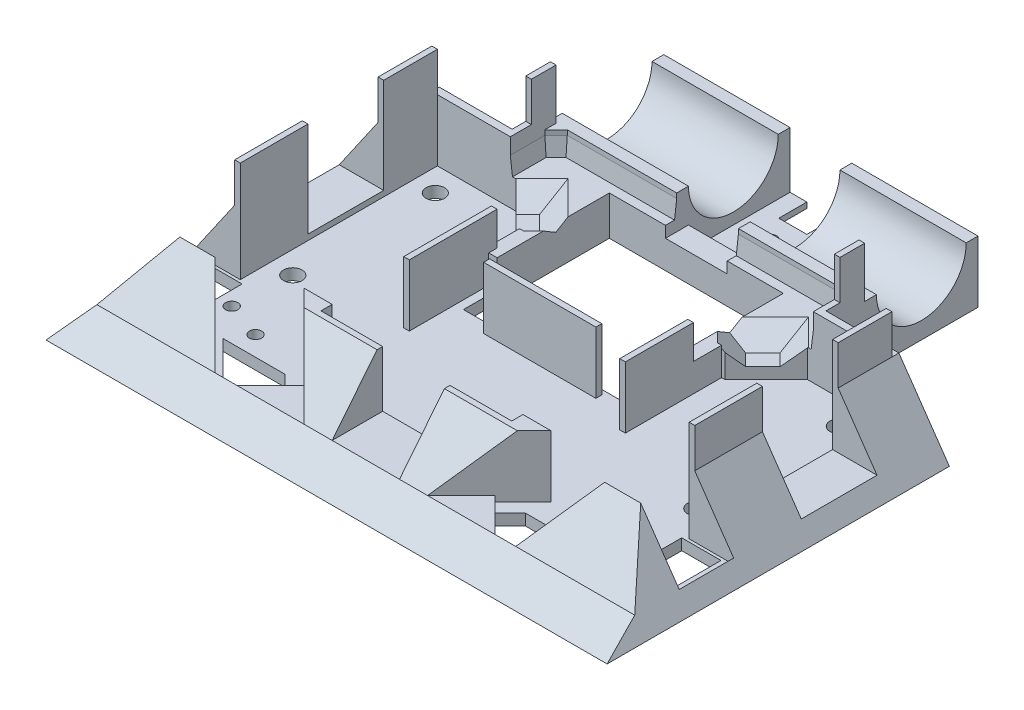
from build123d import *
from OCP.BRepFilletAPI import BRepFilletAPI_MakeChamfer

# Parameters (mm, degrees)
SKETCH1_W                 = 100
SKETCH1_H                 = 95
BOSS_EXTRUDE2_DEPTH       = 20
CUT_EXTRUDE2_DEPTH        = 20
CUT_EXTRUDE3_START        = -22
CUT_EXTRUDE3_DEPTH        = 22
CUT_EXTRUDE4_DEPTH        = 2
SKETCH7_W                 = 12
SKETCH7_H                 = 10
CUT_EXTRUDE5_DEPTH        = 60
BOSS_EXTRUDE3_DEPTH       = 60
BOSS_EXTRUDE3_2_DEPTH     = 60
SKETCH9_W                 = 9.8
SKETCH9_H                 = 15.2
CUT_EXTRUDE6_DEPTH        = 40
SKETCH10_W                = 9.7
SKETCH10_H                = 15.2
CUT_EXTRUDE7_DEPTH        = 40
SKETCH11_W                = 12
SKETCH11_H                = 10
CUT_EXTRUDE8_DEPTH        = 100
SKETCH12_W                = 39.436597342
SKETCH12_H                = 19.718298671
CUT_EXTRUDE9_DEPTH        = 100
CUT_EXTRUDE14_DEPTH       = 100
SKETCH15_W                = 88.678757103
SKETCH15_H                = 15.961506794
CUT_EXTRUDE15_DEPTH       = 100
SKETCH16_W                = 34
SKETCH16_H                = 22
CUT_EXTRUDE16_DEPTH       = 12
SKETCH17_W                = 34
SKETCH17_H                = 12.182986016
BOSS_EXTRUDE4_DEPTH       = 12
SKETCH18_W                = 22
SKETCH18_H                = 34
CUT_EXTRUDE19_DEPTH       = 12
SKETCH19_W                = 36
SKETCH19_H                = 25.876419925
BOSS_EXTRUDE5_DEPTH       = 12
CUT_EXTRUDE20_DEPTH       = 12
SKETCH21_R                = 8.1
CUT_EXTRUDE21_DEPTH       = 100
SKETCH22_W                = 34
SKETCH22_H                = 28.839021914
CUT_EXTRUDE22_DEPTH       = 12
CUT_EXTRUDE23_DEPTH       = 100
CUT_EXTRUDE24_DEPTH       = 12
SKETCH25_W                = 7
SKETCH25_H                = 1.060978086
CUT_EXTRUDE25_DEPTH       = 12
SKETCH26_W                = 1
SKETCH26_H                = 6.751923191
CUT_EXTRUDE26_DEPTH       = 12
SKETCH27_W                = 10
SKETCH27_H                = 20
CUT_EXTRUDE27_DEPTH       = 12
SKETCH28_W                = 15.2
SKETCH28_H                = 9.7
SKETCH28_W_2              = 20.634033895
CUT_EXTRUDE28_DEPTH       = 10
CUT_EXTRUDE29_DEPTH       = 12
SKETCH32_W                = 6.9
SKETCH32_H                = 13
CUT_EXTRUDE30_DEPTH       = 100
SKETCH33_R                = 1.65
CUT_EXTRUDE31_DEPTH       = 10
SKETCH34_W                = 15.575694979
SKETCH34_H                = 1.5
SKETCH34_W_2              = 33.494522517
CUT_EXTRUDE33_DEPTH       = 10
CUT_EXTRUDE34_DEPTH       = 100
SKETCH37_W                = 56
SKETCH37_H                = 20.2
CUT_EXTRUDE35_DEPTH       = 2
SKETCH39_R                = 1.65
CUT_EXTRUDE36_DEPTH       = 5
SKETCH41_W                = 7
SKETCH41_H                = 7
CUT_EXTRUDE37_DEPTH       = 12
CUT_EXTRUDE38_DEPTH       = 25
CUT_EXTRUDE39_DEPTH       = 25
SKETCH44_W                = 10
SKETCH44_H                = 8.7
CUT_EXTRUDE40_DEPTH       = 25
CUT_EXTRUDE41_DEPTH       = 25
SKETCH46_W                = 11
SKETCH46_H                = 11
CUT_EXTRUDE42_DEPTH       = 25
SKETCH47_W                = 1
SKETCH47_H                = 12.058804869
BOSS_EXTRUDE8_DEPTH       = 7
CUT_EXTRUDE46_DEPTH       = 7
SKETCH50_W                = 11
SKETCH50_H                = 6.852562825
SKETCH50_W_2              = 19
SKETCH50_H_2              = 16.839021914
CUT_EXTRUDE47_DEPTH       = 10
SKETCH51_W                = 27
SKETCH51_H                = 23
CUT_EXTRUDE48_DEPTH       = 10
SKETCH52_W                = 11
SKETCH52_H                = 17.852562825
BOSS_EXTRUDE9_DEPTH       = 1
CUT_EXTRUDE49_DEPTH       = 100
CUT_EXTRUDE50_DEPTH       = 10
SKETCH58_W                = 5
SKETCH58_H                = 5
CUT_EXTRUDE51_DEPTH       = 10
SKETCH64_W                = 1
SKETCH64_H                = 8.7
BOSS_EXTRUDE10_DEPTH      = 1
SKETCH65_R                = 1.1
CUT_EXTRUDE52_DEPTH       = 100
SKETCH66_R                = 1.1
SKETCH66_W                = 2
SKETCH66_H                = 8.7
BOSS_EXTRUDE11_DEPTH      = 1
SKETCH67_R                = 1.1
CUT_EXTRUDE53_DEPTH       = 10
BOSS_EXTRUDE12_START      = 1
SKETCH68_R                = 1.65
SKETCH68_R_2              = 1.1
SKETCH68_W                = 7
SKETCH68_H                = 8.7
BOSS_EXTRUDE12_DEPTH      = 1
SKETCH69_W                = 27
SKETCH69_H                = 23
CUT_EXTRUDE54_DEPTH       = 1
CUT_EXTRUDE55_START       = -100
SKETCH70_R                = 1.1
CUT_EXTRUDE55_DEPTH       = 100
SKETCH71_W                = 31
SKETCH71_H                = 27
CUT_EXTRUDE56_DEPTH       = 10
BOSS_EXTRUDE13_DEPTH      = 9
CHAMFER1_SIZE             = 1
CHAMFER1_SIZE_2           = 8.144346428
CHAMFER2_SIZE             = 1
CHAMFER2_SIZE2            = 8.144346428
CHAMFER3_SIZE             = 1
CHAMFER3_SIZE2            = 8.144346428
SKETCH73_W                = 11
SKETCH73_H                = 18.1
CUT_EXTRUDE57_DEPTH       = 1
BOSS_EXTRUDE14_DEPTH      = 5
SKETCH75_W                = 2.5
SKETCH75_H                = 6.488051805
SKETCH75_W_2              = 3.136128614
BOSS_EXTRUDE15_DEPTH      = 11
CUT_EXTRUDE58_DEPTH       = 3
CHAMFER4_SIZE             = 3.575260778
CHAMFER4_SIZE_2           = 3
SKETCH79_W                = 1.5
SKETCH79_H                = 6.488051805
CUT_EXTRUDE59_DEPTH       = 6
SKETCH80_W                = 36
SKETCH80_H                = 5
CUT_EXTRUDE60_DEPTH       = 6
SKETCH81_W                = 0.636128614
SKETCH81_H                = 6.488051805
CUT_EXTRUDE61_DEPTH       = 11
BOSS_EXTRUDE17_DEPTH      = 1
BOSS_EXTRUDE17_DEPTH_BACK = 3
SKETCH84_W                = 9.954004394
SKETCH84_H                = 1.340770626
BOSS_EXTRUDE18_DEPTH      = 6
SKETCH85_W                = 9.954004394
SKETCH85_H                = 0.613922805
BOSS_EXTRUDE19_DEPTH      = 6
SKETCH86_W                = 11
SKETCH86_H                = 4.1
BOSS_EXTRUDE20_DEPTH      = 3
SKETCH87_W                = 3.5
SKETCH87_H                = 11
CUT_EXTRUDE62_DEPTH       = 3
CUT_EXTRUDE63_START       = 2
CUT_EXTRUDE63_DEPTH       = 1
SKETCH91_W                = 11.336755785
SKETCH91_H                = 12.253859608
CUT_EXTRUDE65_DEPTH       = 6
BOSS_EXTRUDE23_START      = -2
BOSS_EXTRUDE23_DEPTH      = 3


with BuildPart() as part:
    # Sketch1 → Boss-Extrude2 (new body)
    with BuildSketch(Plane(origin=(0, 0, 0), x_dir=(1, 0, 0), z_dir=(0, 1, 0))):
        with Locations((9.900990099, -16.559405941)):
            Rectangle(SKETCH1_W, SKETCH1_H)
    extrude(amount=BOSS_EXTRUDE2_DEPTH)

    # Sketch2 → Cut-Extrude2 (cut)
    with BuildSketch(Plane(origin=(59.900990099, 0, 0), x_dir=(0, 0, -1), z_dir=(1, 0, 0))):
        with BuildLine():
            Line((-1.059405941, 0), (28.940594059, 0))
            Line((28.940594059, 0), (30.940594059, 0))
            Line((30.940594059, 0), (30.940594059, 20))
            Line((30.940594059, 20), (25.982188638, 20))
            Line((25.982188638, 20), (1.898999481, 20))
            ThreePointArc((1.898999481, 20), (-2.876419925, 10.487577267), (-1.059405941, 0))
        make_face()
    extrude(amount=-CUT_EXTRUDE2_DEPTH, mode=Mode.SUBTRACT)

    # Sketch3 → Cut-Extrude3 (cut)
    with BuildSketch(Plane.ZY.offset(40.099009901).offset(CUT_EXTRUDE3_START)):
        with BuildLine():
            Line((-1.898999481, 20), (-30.940594059, 20))
            Line((-30.940594059, 20), (-30.940594059, 0))
            Line((-30.940594059, 0), (1.059405941, 0))
            ThreePointArc((1.059405941, 0), (2.876419925, 10.487577267), (-1.898999481, 20))
        make_face()
    extrude(amount=CUT_EXTRUDE3_DEPTH, mode=Mode.SUBTRACT)

    # Sketch5 → Cut-Extrude4 (cut)
    with BuildSketch(Plane(origin=(39.900990099, 0, 0), x_dir=(0, 0, -1), z_dir=(1, 0, 0))):
        with BuildLine():
            Line((19.633434706, 24.018475751), (30.940594059, 20))
            Line((30.940594059, 20), (30.940594059, 0))
            Line((30.940594059, 0), (21.215348762, -7.364828148))
            ThreePointArc((21.215348762, -7.364828148), (-3.037850309, 7.144180617), (19.633434706, 24.018475751))
        make_face()
    extrude(amount=-CUT_EXTRUDE4_DEPTH, mode=Mode.SUBTRACT)

    # Sketch7 → Cut-Extrude5 (cut)
    with BuildSketch(Plane.XY.offset(64.059405941)):
        with Locations((9.900990099, 8)):
            Rectangle(SKETCH7_W, SKETCH7_H)
    extrude(amount=-CUT_EXTRUDE5_DEPTH, mode=Mode.SUBTRACT)

    # Sketch9 → Cut-Extrude6 (cut)
    with BuildSketch(Plane(origin=(33.98019802, 0, 33.98019802), x_dir=(0.7071067811865472, 0, -0.7071067811865479), z_dir=(0.7071067811865479, 0, 0.7071067811865472))):
        with Locations((-47.438423787, 10.6)):
            Rectangle(SKETCH9_W, SKETCH9_H)
    extrude(amount=-CUT_EXTRUDE6_DEPTH, mode=Mode.SUBTRACT)

    # Sketch10 → Cut-Extrude7 (cut)
    with BuildSketch(Plane(origin=(-24.079207921, 0, 24.079207921), x_dir=(0.7071067811865496, 0, 0.7071067811865456), z_dir=(-0.7071067811865456, 0, 0.7071067811865496))):
        with Locations((61.390538266, 10.6)):
            Rectangle(SKETCH10_W, SKETCH10_H)
    extrude(amount=-CUT_EXTRUDE7_DEPTH, mode=Mode.SUBTRACT)

    # Sketch11 → Cut-Extrude8 (cut)
    with BuildSketch(Plane(origin=(59.900990099, 0, 0), x_dir=(0, 0, -1), z_dir=(1, 0, 0))):
        with Locations((-19.876419925, 8)):
            Rectangle(SKETCH11_W, SKETCH11_H)
    extrude(amount=-CUT_EXTRUDE8_DEPTH, mode=Mode.SUBTRACT)

    # Sketch13 → Cut-Extrude14 (cut)
    with BuildSketch(Plane(origin=(59.900990099, 0, 0), x_dir=(0, 0, -1), z_dir=(1, 0, 0))):
        Polygon((-64.059405941, 0), (-57.059405941, 3), (-49.059405941, 13), (-49.059405941, 20), (-64.059405941, 20), (-64.059405941, 13), align=None)
    extrude(amount=-CUT_EXTRUDE14_DEPTH, mode=Mode.SUBTRACT)

    # Sketch15 → Cut-Extrude15 (cut)
    with BuildSketch(Plane(origin=(59.900990099, 0, 0), x_dir=(0, 0, -1), z_dir=(1, 0, 0))):
        with Locations((-4.72002739, 20.980753397)):
            Rectangle(SKETCH15_W, SKETCH15_H)
    extrude(amount=-CUT_EXTRUDE15_DEPTH, mode=Mode.SUBTRACT)

    # Sketch16 → Cut-Extrude16 (cut)
    with BuildSketch(Plane(origin=(0, 13, 0), x_dir=(1, 0, 0), z_dir=(0, 1, 0))):
        with Locations((9.900990099, -37.059405941)):
            Rectangle(SKETCH16_W, SKETCH16_H)
    extrude(amount=-CUT_EXTRUDE16_DEPTH, mode=Mode.SUBTRACT)

    # Sketch17 → Boss-Extrude4 (add)
    with BuildSketch(Plane(origin=(0, 13, 0), x_dir=(1, 0, 0), z_dir=(0, 1, 0))):
        with Locations((9.900990099, -19.967912933)):
            Rectangle(SKETCH17_W, SKETCH17_H)
    extrude(amount=-BOSS_EXTRUDE4_DEPTH)

    # Sketch18 → Cut-Extrude19 (cut)
    with BuildSketch(Plane(origin=(0, 13, 0), x_dir=(1, 0, 0), z_dir=(0, 1, 0))):
        with Locations((-19.099009901, -21.30748275)):
            Rectangle(SKETCH18_W, SKETCH18_H)
        with Locations((38.900990099, -21.30748275)):
            Rectangle(SKETCH18_W, SKETCH18_H)
    extrude(amount=-CUT_EXTRUDE19_DEPTH, mode=Mode.SUBTRACT)

    # Sketch19 → Boss-Extrude5 (add)
    with BuildSketch(Plane(origin=(0, 13, 0), x_dir=(1, 0, 0), z_dir=(0, 1, 0))):
        with Locations((9.900990099, -12.938209963)):
            Rectangle(SKETCH19_W, SKETCH19_H)
    extrude(amount=-BOSS_EXTRUDE5_DEPTH)

    # Sketch20 → Cut-Extrude20 (cut)
    with BuildSketch(Plane(origin=(0, 13, 0), x_dir=(1, 0, 0), z_dir=(0, 1, 0))):
        Polygon((-14.099009901, -46.059405941), (-8.099009901, -46.059405941), (-8.099009901, -39.30748275), (-20.850933092, -39.30748275), align=None)
        Polygon((33.900990099, -46.059405941), (27.900990099, -46.059405941), (27.900990099, -39.30748275), (40.65291329, -39.30748275), align=None)
    extrude(amount=-CUT_EXTRUDE20_DEPTH, mode=Mode.SUBTRACT)

    # Sketch21 → Cut-Extrude21 (cut)
    with BuildSketch(Plane(origin=(37.900990099, 0, 0), x_dir=(0, 0, -1), z_dir=(1, 0, 0))):
        with Locations((13.940594059, 13)):
            Circle(SKETCH21_R)
    extrude(amount=-CUT_EXTRUDE21_DEPTH, mode=Mode.SUBTRACT)

    # Sketch22 → Cut-Extrude22 (cut)
    with BuildSketch(Plane(origin=(0, 13, 0), x_dir=(1, 0, 0), z_dir=(0, 1, 0))):
        with Locations((9.900990099, -10.578916898)):
            Rectangle(SKETCH22_W, SKETCH22_H)
    extrude(amount=-CUT_EXTRUDE22_DEPTH, mode=Mode.SUBTRACT)

    # Sketch23 → Cut-Extrude23 (cut)
    with BuildSketch(Plane(origin=(0, 0, -30.940594059), x_dir=(-1, 0, 0), z_dir=(0, 0, -1))):
        Polygon((-59.900990099, 0), (-50.900990099, 13), (-59.900990099, 13), align=None)
        Polygon((40.099009901, 0), (40.099009901, 13), (31.099009901, 13), align=None)
    extrude(amount=-CUT_EXTRUDE23_DEPTH, mode=Mode.SUBTRACT)

    # Sketch24 → Cut-Extrude24 (cut)
    with BuildSketch(Plane(origin=(0, 13, 0), x_dir=(1, 0, 0), z_dir=(0, 1, 0))):
        Polygon((4.400990099, 3.840594059), (15.400990099, 3.840594059), (15.400990099, 24.040594059), (37.900990099, 24.040594059), (37.900990099, 28.040594059), (15.400990099, 28.040594059), (4.400990099, 28.040594059), (-18.099009901, 28.040594059), (-18.099009901, 24.040594059), (4.400990099, 24.040594059), align=None)
    extrude(amount=-CUT_EXTRUDE24_DEPTH, mode=Mode.SUBTRACT)

    # Sketch25 → Cut-Extrude25 (cut)
    with BuildSketch(Plane(origin=(0, 13, 0), x_dir=(1, 0, 0), z_dir=(0, 1, 0))):
        with Locations((-3.599009901, -25.528916898)):
            Rectangle(SKETCH25_W, SKETCH25_H)
        with Locations((23.400990099, -25.528916898)):
            Rectangle(SKETCH25_W, SKETCH25_H)
    extrude(amount=-CUT_EXTRUDE25_DEPTH, mode=Mode.SUBTRACT)

    # Sketch26 → Cut-Extrude26 (cut)
    with BuildSketch(Plane(origin=(0, 13, 0), x_dir=(1, 0, 0), z_dir=(0, 1, 0))):
        with Locations((-7.599009901, -42.683444346)):
            Rectangle(SKETCH26_W, SKETCH26_H)
        with Locations((27.400990099, -42.683444346)):
            Rectangle(SKETCH26_W, SKETCH26_H)
    extrude(amount=-CUT_EXTRUDE26_DEPTH, mode=Mode.SUBTRACT)

    # Sketch27 → Cut-Extrude27 (cut)
    with BuildSketch(Plane(origin=(0, 13, 0), x_dir=(1, 0, 0), z_dir=(0, 1, 0))):
        with Locations((-12.099009901, -6.159405941)):
            Rectangle(SKETCH27_W, SKETCH27_H)
        with Locations((31.900990099, -6.159405941)):
            Rectangle(SKETCH27_W, SKETCH27_H)
    extrude(amount=-CUT_EXTRUDE27_DEPTH, mode=Mode.SUBTRACT)

    # Sketch28 → Cut-Extrude28 (cut)
    with BuildSketch(Plane(origin=(0, 13, 0), x_dir=(1, 0, 0), z_dir=(0, 1, 0))):
        with Locations((-32.499009901, -44.285224794)):
            Rectangle(SKETCH28_W, SKETCH28_H)
        with Locations((49.583973152, -44.285224794)):
            Rectangle(SKETCH28_W_2, SKETCH28_H)
    extrude(amount=-CUT_EXTRUDE28_DEPTH, mode=Mode.SUBTRACT)

    # Sketch30 → Cut-Extrude29 (cut)
    with BuildSketch(Plane(origin=(0, 13, 0), x_dir=(1, 0, 0), z_dir=(0, 1, 0))):
        Polygon((-3.099009901, -57.059405941), (-14.099009901, -46.059405941), (-14.099009901, -38.30748275), (-30.099009901, -38.30748275), (-30.099009901, -39.435224794), (-38.022086824, -39.435224794), (-38.022086824, -49.135224794), (-24.899009901, -49.118698852), (-16.958302812, -57.059405941), align=None)
        Polygon((49.900990099, -38.30748275), (33.900990099, -38.30748275), (33.900990099, -46.059405941), (22.900990099, -57.059405941), (36.618861654, -57.059405941), (44.5430428, -49.135224794), (57.824067022, -49.135224794), (57.824067022, -39.435224794), (49.900990099, -39.435224794), align=None)
    extrude(amount=-CUT_EXTRUDE29_DEPTH, mode=Mode.SUBTRACT)

    # Sketch32 → Cut-Extrude30 (cut)
    with BuildSketch(Plane(origin=(37.900990099, 0, 0), x_dir=(0, 0, -1), z_dir=(1, 0, 0))):
        with Locations((27.490594059, 6.5)):
            Rectangle(SKETCH32_W, SKETCH32_H)
    extrude(amount=-CUT_EXTRUDE30_DEPTH, mode=Mode.SUBTRACT)

    # Sketch33 → Cut-Extrude31 (cut)
    with BuildSketch(Plane(origin=(0, 1, 0), x_dir=(1, 0, 0), z_dir=(0, 1, 0))):
        with Locations(Location((-26.099009901, -8.676419925, 0), (0, 0, 270))):
            Circle(SKETCH33_R)
        with Locations(Location((-26.099009901, -34.076419925, 0), (0, 0, 270))):
            Circle(SKETCH33_R)
        with Locations(Location((45.900990099, -8.676419925, 0), (0, 0, 270))):
            Circle(SKETCH33_R)
        with Locations(Location((45.900990099, -34.076419925, 0), (0, 0, 270))):
            Circle(SKETCH33_R)
    extrude(amount=-CUT_EXTRUDE31_DEPTH, mode=Mode.SUBTRACT)

    # Sketch34 → Cut-Extrude33 (cut)
    with BuildSketch(Plane(origin=(0, 13, 0), x_dir=(1, 0, 0), z_dir=(0, 1, 0))):
        with Locations((-37.88685739, -26.626419925)):
            Rectangle(SKETCH34_W, SKETCH34_H)
        with Locations((66.648251358, -26.626419925)):
            Rectangle(SKETCH34_W_2, SKETCH34_H)
    extrude(amount=-CUT_EXTRUDE33_DEPTH, mode=Mode.SUBTRACT)

    # Sketch35 → Cut-Extrude34 (cut)
    with BuildSketch(Plane(origin=(37.900990099, 0, 0), x_dir=(0, 0, -1), z_dir=(1, 0, 0))):
        with BuildLine():
            Line((5.940594059, 11), (5.840594059, 13))
            Line((5.840594059, 13), (22.040594059, 13))
            Line((22.040594059, 13), (21.940594059, 11))
            ThreePointArc((21.940594059, 11), (13.940594059, 3), (5.940594059, 11))
        make_face()
    extrude(amount=-CUT_EXTRUDE34_DEPTH, mode=Mode.SUBTRACT)

    # Sketch37 → Cut-Extrude35 (cut)
    with BuildSketch(Plane(origin=(0, 13, 0), x_dir=(1, 0, 0), z_dir=(0, 1, 0))):
        with Locations((9.900990099, 13.940594059)):
            Rectangle(SKETCH37_W, SKETCH37_H)
    extrude(amount=-CUT_EXTRUDE35_DEPTH, mode=Mode.SUBTRACT)

    # Sketch39 → Cut-Extrude36 (cut)
    with BuildSketch(Plane(origin=(0, 1, 0), x_dir=(1, 0, 0), z_dir=(0, 1, 0))):
        with Locations(Location((-2.799009901, -44.059405941, 0), (0, 0, 270))):
            Circle(SKETCH39_R)
        with Locations(Location((22.600990099, -44.059405941, 0), (0, 0, 270))):
            Circle(SKETCH39_R)
    extrude(amount=-CUT_EXTRUDE36_DEPTH, mode=Mode.SUBTRACT)

    # Sketch41 → Cut-Extrude37 (cut)
    with BuildSketch(Plane(origin=(0, 13, 0), x_dir=(1, 0, 0), z_dir=(0, 1, 0))):
        with Locations((-10.599009901, -35.80748275)):
            Rectangle(SKETCH41_W, SKETCH41_H)
        with Locations((30.400990099, -35.80748275)):
            Rectangle(SKETCH41_W, SKETCH41_H)
    extrude(amount=-CUT_EXTRUDE37_DEPTH, mode=Mode.SUBTRACT)

    # Sketch42 → Cut-Extrude38 (cut)
    with BuildSketch(Plane(origin=(37.900990099, 0, 0), x_dir=(0, 0, -1), z_dir=(1, 0, 0))):
        Polygon((-1.059405941, 0), (-3.059405941, 0), (-3.059405941, 8), (-3.059405941, 15.939002548), (1.308469824, 15.939002548), (1.308469824, 8), (-1.059405941, 8), align=None)
    extrude(amount=CUT_EXTRUDE38_DEPTH, mode=Mode.SUBTRACT)

    # Sketch43 → Cut-Extrude39 (cut)
    with BuildSketch(Plane.ZY.offset(18.099009901)):
        Polygon((2.981597763, 6.375369602), (2.981597763, -7.803854609), (-7.1703855, -7.803854609), (-7.1703855, 6.375369602), (-10.507998994, 6.375369602), (-10.507998994, 23.166093854), (2.981597763, 23.166093854), align=None)
    extrude(amount=CUT_EXTRUDE39_DEPTH, mode=Mode.SUBTRACT)

    # Sketch44 → Cut-Extrude40 (cut)
    with BuildSketch(Plane(origin=(0, 1, 0), x_dir=(1, 0, 0), z_dir=(0, 1, 0))):
        with Locations((-32.272086824, -44.285224794)):
            Rectangle(SKETCH44_W, SKETCH44_H)
        with Locations((52.074067022, -44.285224794)):
            Rectangle(SKETCH44_W, SKETCH44_H)
    extrude(amount=-CUT_EXTRUDE40_DEPTH, mode=Mode.SUBTRACT)

    # Sketch45 → Cut-Extrude41 (cut)
    with BuildSketch(Plane(origin=(0, 1, 0), x_dir=(1, 0, 0), z_dir=(0, 1, 0))):
        Polygon((-16.54408925, -56.059405941), (-21.612237597, -50.991257593), (-10.581371811, -50.991257593), (-5.513223463, -56.059405941), align=None)
        Polygon((25.315203661, -56.059405941), (30.539549613, -50.835059989), (41.428994043, -50.835059989), (36.204648092, -56.059405941), align=None)
    extrude(amount=-CUT_EXTRUDE41_DEPTH, mode=Mode.SUBTRACT)

    # Sketch46 → Cut-Extrude42 (cut)
    with BuildSketch(Plane(origin=(0, 1, 0), x_dir=(1, 0, 0), z_dir=(0, 1, 0))):
        with Locations((-18.599009901, -24.80748275)):
            Rectangle(SKETCH46_W, SKETCH46_H)
        with Locations((38.400990099, -24.80748275)):
            Rectangle(SKETCH46_W, SKETCH46_H)
    extrude(amount=-CUT_EXTRUDE42_DEPTH, mode=Mode.SUBTRACT)

    # Sketch47 → Boss-Extrude8 (add)
    with BuildSketch(Plane(origin=(0, 13, 0), x_dir=(1, 0, 0), z_dir=(0, 1, 0))):
        Polygon((50.900990099, -13.876419925), (50.900990099, -3.059405941), (37.900990099, -3.059405941), (37.900990099, 3.840594059), (36.900990099, 3.840594059), (36.900990099, -4.30748275), (49.900990099, -4.30748275), (49.900990099, -13.876419925), align=None)
        with Locations((50.400990099, -33.40582236)):
            Rectangle(SKETCH47_W, SKETCH47_H)
        with Locations((-30.599009901, -33.40582236)):
            Rectangle(SKETCH47_W, SKETCH47_H)
        Polygon((-30.099009901, -13.876419925), (-30.099009901, -4.30748275), (-17.099009901, -4.30748275), (-17.099009901, 3.840594059), (-18.099009901, 3.840594059), (-18.099009901, -2.981597763), (-31.099009901, -2.981597763), (-31.099009901, -13.876419925), align=None)
    extrude(amount=BOSS_EXTRUDE8_DEPTH)

    # Sketch49 → Cut-Extrude46 (cut)
    with BuildSketch(Plane(origin=(0, 20, 0), x_dir=(1, 0, 0), z_dir=(0, 1, 0))):
        Polygon((-23.599009901, -4.30748275), (43.400990099, -4.30748275), (50.900990099, -4.30748275), (50.900990099, -0.55748275), (43.400990099, -0.55748275), (-23.599009901, -0.55748275), (-31.099009901, -0.55748275), (-31.099009901, -4.30748275), align=None)
    extrude(amount=-CUT_EXTRUDE46_DEPTH, mode=Mode.SUBTRACT)

    # Sketch50 → Cut-Extrude47 (cut)
    with BuildSketch(Plane(origin=(0, 1, 0), x_dir=(1, 0, 0), z_dir=(0, 1, 0))):
        with Locations((-18.599009901, -15.881201338)):
            Rectangle(SKETCH50_W, SKETCH50_H)
        with Locations((38.400990099, -15.881201338)):
            Rectangle(SKETCH50_W, SKETCH50_H)
        with Locations((9.900990099, -10.578916898)):
            Rectangle(SKETCH50_W_2, SKETCH50_H_2)
    extrude(amount=-CUT_EXTRUDE47_DEPTH, mode=Mode.SUBTRACT)

    # Sketch51 → Cut-Extrude48 (cut)
    with BuildSketch(Plane(origin=(0, 1, 0), x_dir=(1, 0, 0), z_dir=(0, 1, 0))):
        with Locations((9.900990099, -10.659405941)):
            Rectangle(SKETCH51_W, SKETCH51_H)
    extrude(amount=-CUT_EXTRUDE48_DEPTH, mode=Mode.SUBTRACT)

    # Sketch52 → Boss-Extrude9 (add)
    with BuildSketch(Plane(origin=(0, 1, 0), x_dir=(1, 0, 0), z_dir=(0, 1, 0))):
        with Locations((-18.599009901, -21.381201338)):
            Rectangle(SKETCH52_W, SKETCH52_H)
        with Locations((38.400990099, -21.381201338)):
            Rectangle(SKETCH52_W, SKETCH52_H)
    extrude(amount=-BOSS_EXTRUDE9_DEPTH)

    # Sketch53 → Cut-Extrude49 (cut)
    with BuildSketch(Plane(origin=(0, 1, 0), x_dir=(1, 0, 0), z_dir=(0, 1, 0))):
        Polygon((-3.099009901, -57.059405941), (-1.099009901, -57.059405941), (-12.099009901, -46.059405941), (-14.099009901, -46.059405941), align=None)
        Polygon((22.900990099, -57.059405941), (33.900990099, -46.059405941), (31.900990099, -46.059405941), (20.900990099, -57.059405941), align=None)
    extrude(amount=CUT_EXTRUDE49_DEPTH, mode=Mode.SUBTRACT)

    # Sketch56 → Cut-Extrude50 (cut)
    with BuildSketch(Plane(origin=(0, 0, 0), x_dir=(-1, 0, 0), z_dir=(0, -1, 0))):
        Polygon((16.54408925, -56.059405941), (23.968710452, -48.634784738), (12.937844666, -48.634784738), (5.513223463, -56.059405941), align=None)
        Polygon((-25.315203661, -56.059405941), (-36.204648092, -56.059405941), (-41.428994043, -50.835059989), (-43.629269294, -48.634784738), (-32.739824864, -48.634784738), align=None)
    extrude(amount=-CUT_EXTRUDE50_DEPTH, mode=Mode.SUBTRACT)

    # Sketch58 → Cut-Extrude51 (cut)
    with BuildSketch(Plane(origin=(0, 1, 0), x_dir=(1, 0, 0), z_dir=(0, 1, 0))):
        with Locations((9.900990099, 21.540594059)):
            Rectangle(SKETCH58_W, SKETCH58_H)
    extrude(amount=-CUT_EXTRUDE51_DEPTH, mode=Mode.SUBTRACT)

    # Sketch64 → Boss-Extrude10 (add)
    with BuildSketch(Plane(origin=(0, 1, 0), x_dir=(1, 0, 0), z_dir=(0, 1, 0))):
        with Locations((-36.772086824, -44.285224794)):
            Rectangle(SKETCH64_W, SKETCH64_H)
        with Locations((56.574067022, -44.285224794)):
            Rectangle(SKETCH64_W, SKETCH64_H)
        Polygon((-23.968710452, -48.634784738), (-12.937844666, -48.634784738), (-11.523631103, -50.048998301), (-22.55449689, -50.048998301), align=None)
        Polygon((32.739824864, -48.634784738), (43.629269294, -48.634784738), (42.215055732, -50.048998301), (31.325611301, -50.048998301), align=None)
    extrude(amount=-BOSS_EXTRUDE10_DEPTH)

    # Sketch65 → Cut-Extrude52 (cut)
    with BuildSketch(Plane(origin=(0, 1, 0), x_dir=(1, 0, 0), z_dir=(0, 1, 0))):
        with Locations(Location((9.900990099, 15.040594059, 0), (0, 0, 270))):
            Circle(SKETCH65_R)
        with Locations(Location((9.900990099, 9.040594059, 0), (0, 0, 270))):
            Circle(SKETCH65_R)
        with Locations(Location((-24.772086824, -44.285224794, 0), (0, 0, 270))):
            Circle(SKETCH65_R)
        with Locations(Location((44.574067022, -44.285224794, 0), (0, 0, 270))):
            Circle(SKETCH65_R)
        with Locations(Location((-20.272086824, -46.548998301, 0), (0, 0, 270))):
            Circle(SKETCH65_R)
        with Locations(Location((40.074067022, -46.548998301, 0), (0, 0, 270))):
            Circle(SKETCH65_R)
    extrude(amount=-CUT_EXTRUDE52_DEPTH, mode=Mode.SUBTRACT)

    # Sketch66 → Boss-Extrude11 (add)
    with BuildSketch(Plane(origin=(0, 1, 0), x_dir=(1, 0, 0), z_dir=(0, 1, 0))):
        with Locations((-24.772086824, -44.285224794)):
            Circle(SKETCH66_R)
        with Locations((44.574067022, -44.285224794)):
            Circle(SKETCH66_R)
        with Locations((-28.272086824, -44.285224794)):
            Rectangle(SKETCH66_W, SKETCH66_H)
        with Locations((48.074067022, -44.285224794)):
            Rectangle(SKETCH66_W, SKETCH66_H)
    extrude(amount=-BOSS_EXTRUDE11_DEPTH)

    # Sketch67 → Cut-Extrude53 (cut)
    with BuildSketch(Plane(origin=(0, 1, 0), x_dir=(1, 0, 0), z_dir=(0, 1, 0))):
        with Locations(Location((-26.772086824, -44.285224794, 0), (0, 0, 270))):
            Circle(SKETCH67_R)
        with Locations(Location((46.724067022, -44.285224794, 0), (0, 0, 270))):
            Circle(SKETCH67_R)
    extrude(amount=-CUT_EXTRUDE53_DEPTH, mode=Mode.SUBTRACT)

    # Sketch68 → Boss-Extrude12 (add)
    with BuildSketch(Plane(origin=(0, 1, 0), x_dir=(1, 0, 0), z_dir=(0, 1, 0)).offset(BOSS_EXTRUDE12_START)):
        Polygon((-30.099009901, -4.30748275), (-17.099009901, -4.30748275), (-17.099009901, 3.840594059), (4.400990099, 3.840594059), (4.400990099, 24.040594059), (7.400990099, 24.040594059), (7.400990099, 19.040594059), (12.400990099, 19.040594059), (12.400990099, 24.040594059), (15.400990099, 24.040594059), (15.400990099, 3.840594059), (36.900990099, 3.840594059), (36.900990099, -4.30748275), (49.900990099, -4.30748275), (49.900990099, -39.435224794), (57.824067022, -39.435224794), (57.824067022, -49.135224794), (44.5430428, -49.135224794), (36.618861654, -57.059405941), (20.900990099, -57.059405941), (31.900990099, -46.059405941), (26.900990099, -46.059405941), (26.900990099, -48.059405941), (-7.099009901, -48.059405941), (-7.099009901, -46.059405941), (-12.099009901, -46.059405941), (-1.099009901, -57.059405941), (-16.958302812, -57.059405941), (-24.899009901, -49.118698852), (-38.022086824, -49.135224794), (-38.022086824, -39.435224794), (-30.099009901, -39.435224794), align=None)
        with Locations(Location((-26.099009901, -8.676419925, 0), (0, 0, 270))):
            Circle(SKETCH68_R, mode=Mode.SUBTRACT)
        with Locations(Location((-26.099009901, -34.076419925, 0), (0, 0, 270))):
            Circle(SKETCH68_R, mode=Mode.SUBTRACT)
        with Locations(Location((-26.772086824, -44.285224794, 0), (0, 0, 270))):
            Circle(SKETCH68_R_2, mode=Mode.SUBTRACT)
        with Locations(Location((-20.272086824, -46.548998301, 0), (0, 0, 270))):
            Circle(SKETCH68_R_2, mode=Mode.SUBTRACT)
        with Locations(Location((-2.799009901, -44.059405941, 0), (0, 0, 270))):
            Circle(SKETCH68_R, mode=Mode.SUBTRACT)
        with Locations(Location((45.900990099, -8.676419925, 0), (0, 0, 270))):
            Circle(SKETCH68_R, mode=Mode.SUBTRACT)
        with Locations(Location((45.900990099, -34.076419925, 0), (0, 0, 270))):
            Circle(SKETCH68_R, mode=Mode.SUBTRACT)
        with Locations(Location((46.724067022, -44.285224794, 0), (0, 0, 270))):
            Circle(SKETCH68_R_2, mode=Mode.SUBTRACT)
        with Locations(Location((40.074067022, -46.548998301, 0), (0, 0, 270))):
            Circle(SKETCH68_R_2, mode=Mode.SUBTRACT)
        with Locations(Location((22.600990099, -44.059405941, 0), (0, 0, 270))):
            Circle(SKETCH68_R, mode=Mode.SUBTRACT)
        Polygon((-22.55449689, -50.048998301), (-11.523631103, -50.048998301), (-5.513223463, -56.059405941), (-16.54408925, -56.059405941), align=None, mode=Mode.SUBTRACT)
        Polygon((31.325611301, -50.048998301), (42.215055732, -50.048998301), (36.204648092, -56.059405941), (25.315203661, -56.059405941), align=None, mode=Mode.SUBTRACT)
        with Locations((-32.772086824, -44.285224794)):
            Rectangle(SKETCH68_W, SKETCH68_H, mode=Mode.SUBTRACT)
        with Locations((52.574067022, -44.285224794)):
            Rectangle(SKETCH68_W, SKETCH68_H, mode=Mode.SUBTRACT)
    extrude(amount=-BOSS_EXTRUDE12_DEPTH)

    # Sketch69 → Cut-Extrude54 (cut)
    with BuildSketch(Plane(origin=(0, 1, 0), x_dir=(-1, 0, 0), z_dir=(0, -1, 0))):
        with Locations((-9.900990099, -10.659405941)):
            Rectangle(SKETCH69_W, SKETCH69_H)
    extrude(amount=-CUT_EXTRUDE54_DEPTH, mode=Mode.SUBTRACT)

    # Sketch70 → Cut-Extrude55 (cut)
    with BuildSketch(Plane(origin=(0, 0, 0), x_dir=(-1, 0, 0), z_dir=(0, -1, 0)).offset(CUT_EXTRUDE55_START)):
        with Locations(Location((-9.900990099, 15.040594059, 0), (0, 0, 270))):
            Circle(SKETCH70_R)
        with Locations(Location((-9.900990099, 9.040594059, 0), (0, 0, 270))):
            Circle(SKETCH70_R)
    extrude(amount=CUT_EXTRUDE55_DEPTH, mode=Mode.SUBTRACT)

    # Sketch71 → Cut-Extrude56 (cut)
    with BuildSketch(Plane(origin=(0, 2, 0), x_dir=(1, 0, 0), z_dir=(0, 1, 0))):
        with Locations((9.900990099, -10.659405941)):
            Rectangle(SKETCH71_W, SKETCH71_H)
    extrude(amount=-CUT_EXTRUDE56_DEPTH, mode=Mode.SUBTRACT)

    # Sketch72 → Boss-Extrude13 (add)
    with BuildSketch(Plane(origin=(0, 2, 0), x_dir=(1, 0, 0), z_dir=(0, 1, 0))):
        Polygon((-17.099009901, 1.840594059), (-15.099009901, 3.840594059), (-17.099009901, 3.840594059), align=None)
        Polygon((36.900990099, 1.840594059), (34.900990099, 3.840594059), (36.900990099, 3.840594059), align=None)
    extrude(amount=BOSS_EXTRUDE13_DEPTH)

    # Chamfer1
    chamfer1_edges_1 = [part.edges().sort_by_distance(p)[0] for p in [
        (-5.349009901, 2, -3.840594059),
    ]]
    chamfer1_side_1 = [part.faces().sort_by_distance(p)[0] for p in [
        (-5.349009901, 2, -3.820594059),
    ]]
    chamfer1_edges_2 = [part.edges().sort_by_distance(p)[0] for p in [
        (25.150990099, 2, -3.840594059),
    ]]
    chamfer1_side_2 = [part.faces().sort_by_distance(p)[0] for p in [
        (25.150990099, 2, -3.820594059),
    ]]
    chamfer1 = BRepFilletAPI_MakeChamfer(part.part.solid().wrapped)
    for e in chamfer1_edges_1:
        chamfer1.Add(CHAMFER1_SIZE - 0.0001, CHAMFER1_SIZE_2 - 0.0001, e.wrapped, chamfer1_side_1[0].wrapped)
    for e in chamfer1_edges_2:
        chamfer1.Add(CHAMFER1_SIZE - 0.0001, CHAMFER1_SIZE_2 - 0.0001, e.wrapped, chamfer1_side_2[0].wrapped)
    add(Compound.cast(chamfer1.Shape()), mode=Mode.REPLACE)  # a hair under: the kernel refuses the full size

    # Chamfer2
    chamfer2_edges = [part.edges().sort_by_distance(p)[0] for p in [
        (-16.598959901, 2, -2.340644059),
        (-17.099009901, 2, 1.233444345),
    ]]
    chamfer2_side = [part.faces().sort_by_distance(p)[0] for p in [
        (35.513142397, 2, -1.452846357),
    ]]
    chamfer(chamfer2_edges, length=CHAMFER2_SIZE, length2=CHAMFER2_SIZE2, reference=chamfer2_side[0])

    # Chamfer3
    chamfer3_edges = [part.edges().sort_by_distance(p)[0] for p in [
        (36.900990099, 2, 1.233444345),
        (36.400940099, 2, -2.340644059),
    ]]
    chamfer3_side = [part.faces().sort_by_distance(p)[0] for p in [
        (9.960337176, 2, 26.095106735),
    ]]
    chamfer(chamfer3_edges, length=CHAMFER3_SIZE, length2=CHAMFER3_SIZE2, reference=chamfer3_side[0])

    # Sketch73 → Cut-Extrude57 (cut)
    with BuildSketch(Plane(origin=(0, 2, 0), x_dir=(1, 0, 0), z_dir=(0, 1, 0))):
        with Locations((9.900990099, 14.990594059)):
            Rectangle(SKETCH73_W, SKETCH73_H)
    extrude(amount=-CUT_EXTRUDE57_DEPTH, mode=Mode.SUBTRACT)

    # Sketch74 → Boss-Extrude14 (add)
    with BuildSketch(Plane(origin=(0, 2, 0), x_dir=(1, 0, 0), z_dir=(0, 1, 0))):
        Polygon((-16.099009901, -4.30748275), (-5.599009901, -14.80748275), (-5.599009901, 2.840594059), (-17.099009901, 2.840594059), (-17.099009901, -4.30748275), align=None)
        Polygon((25.400990099, -14.80748275), (35.900990099, -4.30748275), (36.900990099, -4.30748275), (36.900990099, 2.840594059), (25.400990099, 2.840594059), align=None)
    extrude(amount=BOSS_EXTRUDE14_DEPTH)

    # Sketch75 → Boss-Extrude15 (add)
    with BuildSketch(Plane(origin=(0, 2, 0), x_dir=(1, 0, 0), z_dir=(0, 1, 0))):
        with Locations((-6.849009901, -14.915380039)):
            Rectangle(SKETCH75_W, SKETCH75_H)
        with Locations((26.969054406, -14.915380039)):
            Rectangle(SKETCH75_W_2, SKETCH75_H)
    extrude(amount=BOSS_EXTRUDE15_DEPTH)

    # Sketch76 → Cut-Extrude58 (cut)
    with BuildSketch(Plane(origin=(0, 7, 0), x_dir=(1, 0, 0), z_dir=(0, 1, 0))):
        Polygon((-13.624136167, -6.782356484), (-10.573883635, -9.832609016), (-8.452563292, -7.711288672), (-11.502815823, -4.66103614), align=None)
        Polygon((30.375863833, -9.832609016), (33.426116365, -6.782356484), (31.304796021, -4.66103614), (28.25454349, -7.711288672), align=None)
    extrude(amount=-CUT_EXTRUDE58_DEPTH, mode=Mode.SUBTRACT)

    # Chamfer4
    # the kernel refuses this chamfer: 3.575260778, 3 mm, written as the material it takes off along each edge
    with BuildSketch(Plane(origin=(21.738625954, 7, 1.195371137), x_dir=(-0.707106781186547, 0, 0.707106781186548), z_dir=(0.707106781186548, 0, 0.7071067811865471))) as chamfer4_piece_1_section:
        Polygon((CHAMFER4_SIZE, 0), (0, CHAMFER4_SIZE_2), (0, 0), align=None)
    chamfer4_piece_1 = extrude(amount=21.429797899, mode=Mode.PRIVATE)
    chamfer4_piece_1 = split(chamfer4_piece_1, bisect_by=Plane(origin=(21.738625954, 7, 11.671354136), z_dir=(0, 0, -1)), keep=Keep.TOP, mode=Mode.PRIVATE)
    chamfer4_piece_1 = split(chamfer4_piece_1, bisect_by=Plane(origin=(23.386299759, 9.776979698, 2.843044941), z_dir=(0.4545194776720431, 0.7660444431189792, 0.4545194776720424)), keep=Keep.TOP, mode=Mode.PRIVATE)
    add(chamfer4_piece_1, mode=Mode.SUBTRACT)
    with BuildSketch(Plane(origin=(39.9420339, 7, 13.298274019), x_dir=(0.7071067811865545, 0, -0.7071067811865406), z_dir=(-0.7071067811865406, 0, -0.7071067811865545))) as chamfer4_piece_2_section:
        Polygon((CHAMFER4_SIZE, 0), (0, CHAMFER4_SIZE_2), (0, 0), align=None)
    chamfer4_piece_2 = extrude(amount=21.429797899, mode=Mode.PRIVATE)
    chamfer4_piece_2 = split(chamfer4_piece_2, bisect_by=Plane(origin=(35.328788909, -0.77513586, 8.685029028), z_dir=(0.4545194776720431, 0.7660444431189792, 0.4545194776720424)), keep=Keep.TOP, mode=Mode.PRIVATE)
    add(chamfer4_piece_2, mode=Mode.SUBTRACT)
    with BuildSketch(Plane(origin=(37.820713557, 7, -1.854881395), x_dir=(-0.707106781186548, 0, -0.707106781186547), z_dir=(-0.7071067811865471, 0, 0.707106781186548))) as chamfer4_piece_3_section:
        Polygon((CHAMFER4_SIZE, 0), (0, CHAMFER4_SIZE_2), (0, 0), align=None)
    chamfer4_piece_3 = extrude(amount=22.743506398, mode=Mode.PRIVATE)
    chamfer4_piece_3 = split(chamfer4_piece_3, bisect_by=Plane(origin=(36.173039752, 9.776979698, -0.207207591), z_dir=(-0.45451947767204737, 0.7660444431189791, 0.4545194776720385)), keep=Keep.TOP, mode=Mode.PRIVATE)
    chamfer4_piece_3 = split(chamfer4_piece_3, bisect_by=Plane(origin=(32.823656162, -1.422011018, 3.142175999), z_dir=(0.45451947767204254, 0.7660444431189792, -0.45451947767204304)), keep=Keep.TOP, mode=Mode.PRIVATE)
    add(chamfer4_piece_3, mode=Mode.SUBTRACT)
    with BuildSketch(Plane(origin=(-17.08980117, 7, 16.348526551), x_dir=(0.707106781186548, 0, 0.707106781186547), z_dir=(0.707106781186547, 0, -0.7071067811865481))) as chamfer4_piece_4_section:
        Polygon((CHAMFER4_SIZE, 0), (0, CHAMFER4_SIZE_2), (0, 0), align=None)
    chamfer4_piece_4 = extrude(amount=21.429797899, mode=Mode.PRIVATE)
    chamfer4_piece_4 = split(chamfer4_piece_4, bisect_by=Plane(origin=(-8.099009901, 7, 16.348526551), z_dir=(-1, 0, 0)), keep=Keep.TOP, mode=Mode.PRIVATE)
    chamfer4_piece_4 = split(chamfer4_piece_4, bisect_by=Plane(origin=(-12.476556179, -0.77513586, 11.73528156), z_dir=(-0.4545194776720426, 0.7660444431189795, 0.45451947767204287)), keep=Keep.TOP, mode=Mode.PRIVATE)
    add(chamfer4_piece_4, mode=Mode.SUBTRACT)
    with BuildSketch(Plane(origin=(-17.08980117, 7, 16.348526551), x_dir=(0.707106781186548, 0, 0.707106781186547), z_dir=(0.707106781186547, 0, -0.7071067811865481))) as chamfer4_piece_5_section:
        Polygon((CHAMFER4_SIZE, 0), (0, CHAMFER4_SIZE_2), (0, 0), align=None)
    chamfer4_piece_5 = extrude(amount=21.429797899, mode=Mode.PRIVATE)
    chamfer4_piece_5 = split(chamfer4_piece_5, bisect_by=Plane(origin=(-17.08980117, 7, 11.671354136), z_dir=(0, 0, -1)), keep=Keep.TOP, mode=Mode.PRIVATE)
    chamfer4_piece_5 = split(chamfer4_piece_5, bisect_by=Plane(origin=(-12.476556179, -0.77513586, 11.73528156), z_dir=(-0.4545194776720426, 0.7660444431189795, 0.45451947767204287)), keep=Keep.TOP, mode=Mode.PRIVATE)
    add(chamfer4_piece_5, mode=Mode.SUBTRACT)
    with BuildSketch(Plane(origin=(-1.936645756, 7, 14.227206207), x_dir=(0.7071067811865472, 0, -0.7071067811865478), z_dir=(-0.7071067811865478, 0, -0.7071067811865474))) as chamfer4_piece_6_section:
        Polygon((CHAMFER4_SIZE, 0), (0, CHAMFER4_SIZE_2), (0, 0), align=None)
    chamfer4_piece_6 = extrude(amount=22.743506398, mode=Mode.PRIVATE)
    chamfer4_piece_6 = split(chamfer4_piece_6, bisect_by=Plane(origin=(-3.584319561, 9.776979698, 12.579532403), z_dir=(-0.454519477672043, 0.7660444431189796, -0.45451947767204215)), keep=Keep.TOP, mode=Mode.PRIVATE)
    chamfer4_piece_6 = split(chamfer4_piece_6, bisect_by=Plane(origin=(-6.933703151, -1.422011018, 9.230148813), z_dir=(0.4545194776720432, 0.7660444431189791, 0.4545194776720423)), keep=Keep.TOP, mode=Mode.PRIVATE)
    add(chamfer4_piece_6, mode=Mode.SUBTRACT)
    with BuildSketch(Plane(origin=(-4.986898288, 7, -1.854881395), x_dir=(-0.7071067811865482, 0, -0.7071067811865468), z_dir=(-0.7071067811865469, 0, 0.7071067811865483))) as chamfer4_piece_7_section:
        Polygon((CHAMFER4_SIZE, 0), (0, CHAMFER4_SIZE_2), (0, 0), align=None)
    chamfer4_piece_7 = extrude(amount=21.429797899, mode=Mode.PRIVATE)
    chamfer4_piece_7 = split(chamfer4_piece_7, bisect_by=Plane(origin=(-6.634572092, 9.776979698, -0.207207591), z_dir=(-0.4545194776720426, 0.7660444431189795, 0.45451947767204287)), keep=Keep.TOP, mode=Mode.PRIVATE)
    add(chamfer4_piece_7, mode=Mode.SUBTRACT)

    # Sketch79 → Cut-Extrude59 (cut)
    with BuildSketch(Plane(origin=(0, 13, 0), x_dir=(1, 0, 0), z_dir=(0, 1, 0))):
        with Locations((-6.349009901, -14.915380039)):
            Rectangle(SKETCH79_W, SKETCH79_H)
        with Locations((26.150990099, -14.915380039)):
            Rectangle(SKETCH79_W, SKETCH79_H)
    extrude(amount=-CUT_EXTRUDE59_DEPTH, mode=Mode.SUBTRACT)

    # Sketch80 → Cut-Extrude60 (cut)
    with BuildSketch(Plane(origin=(0, 13, 0), x_dir=(1, 0, 0), z_dir=(0, 1, 0))):
        with Locations((9.900990099, -14.171354136)):
            Rectangle(SKETCH80_W, SKETCH80_H)
    extrude(amount=-CUT_EXTRUDE60_DEPTH, mode=Mode.SUBTRACT)

    # Sketch81 → Cut-Extrude61 (cut)
    with BuildSketch(Plane(origin=(0, 13, 0), x_dir=(1, 0, 0), z_dir=(0, 1, 0))):
        with Locations((28.219054406, -14.915380039)):
            Rectangle(SKETCH81_W, SKETCH81_H)
    extrude(amount=-CUT_EXTRUDE61_DEPTH, mode=Mode.SUBTRACT)

    # Sketch83 → Boss-Extrude17 (add, two sides: drawn at the far end of the back side and taken through both)
    with BuildSketch(Plane.XY.offset(-2.840594059).offset(-BOSS_EXTRUDE17_DEPTH_BACK)):
        Polygon((-5.599009901, 0), (25.400990099, 0), (25.400990099, 7), (15.400990099, 7), (15.400990099, 2), (4.400990099, 2), (4.400990099, 7), (-5.599009901, 7), align=None)
    extrude(amount=BOSS_EXTRUDE17_DEPTH + BOSS_EXTRUDE17_DEPTH_BACK)

    # Sketch84 → Boss-Extrude18 (add)
    with BuildSketch(Plane(origin=(0, 7, 0), x_dir=(1, 0, 0), z_dir=(0, 1, 0))):
        with Locations((-10.576012098, 3.510979372)):
            Rectangle(SKETCH84_W, SKETCH84_H)
    extrude(amount=-BOSS_EXTRUDE18_DEPTH)

    # Sketch85 → Boss-Extrude19 (add)
    with BuildSketch(Plane(origin=(0, 7, 0), x_dir=(1, 0, 0), z_dir=(0, 1, 0))):
        with Locations((30.377992296, 3.147555462)):
            Rectangle(SKETCH85_W, SKETCH85_H)
    extrude(amount=-BOSS_EXTRUDE19_DEPTH)

    # Sketch86 → Boss-Extrude20 (add)
    with BuildSketch(Plane(origin=(0, 2, 0), x_dir=(1, 0, 0), z_dir=(0, 1, 0))):
        with Locations((9.900990099, 3.890594059)):
            Rectangle(SKETCH86_W, SKETCH86_H)
    extrude(amount=BOSS_EXTRUDE20_DEPTH)

    # Sketch87 → Cut-Extrude62 (cut)
    with BuildSketch(Plane(origin=(27.900990099, 0, 0), x_dir=(0, 0, -1), z_dir=(1, 0, 0))):
        with Locations((-30.55748275, 7.5)):
            Rectangle(SKETCH87_W, SKETCH87_H)
    extrude(amount=-CUT_EXTRUDE62_DEPTH, mode=Mode.SUBTRACT)

    # Cut-Extrude63: read off the stored shape, not the designer's step
    # Cut-Extrude63 outline → Cut-Extrude63 (cut)
    with BuildSketch(Plane(origin=(0, 0, 0), x_dir=(1, 0, 0), z_dir=(0, 1, 0)).offset(CUT_EXTRUDE63_START)):
        Polygon((-24.899009901, -49.118698852), (-38.022086824, -49.135224794), (-24.89898909, -49.135224794), align=None)
    extrude(amount=CUT_EXTRUDE63_DEPTH, mode=Mode.SUBTRACT)

    # Sketch91 → Cut-Extrude65 (cut)
    with BuildSketch(Plane(origin=(0, 0, 49.135224794), x_dir=(-1, 0, 0), z_dir=(0, 0, -1))):
        with Locations((28.246960587, 8.126929804)):
            Rectangle(SKETCH91_W, SKETCH91_H)
    extrude(amount=CUT_EXTRUDE65_DEPTH, mode=Mode.SUBTRACT)

    # Sketch92 → Boss-Extrude23 (add)
    with BuildSketch(Plane(origin=(0, 2, 0), x_dir=(1, 0, 0), z_dir=(0, 1, 0)).offset(BOSS_EXTRUDE23_START)):
        Polygon((-13.099009901, -57.059405941), (-7.099009901, -51.059405941), (-1.099009901, -57.059405941), align=None)
        Polygon((20.900990099, -57.059405941), (32.900990099, -57.059405941), (26.900990099, -51.059405941), align=None)
    extrude(amount=BOSS_EXTRUDE23_DEPTH)


with BuildPart() as body_2:
    # Sketch8 → Boss-Extrude3 (new body)
    with BuildSketch(Plane(origin=(0, 20, 0), x_dir=(1, 0, 0), z_dir=(0, 1, 0))):
        Polygon((15.900990099, -64.059405941), (19.900990099, -68.059405941), (19.900990099, -64.059405941), align=None)
    extrude(amount=BOSS_EXTRUDE3_DEPTH)


with BuildPart() as body_3:
    # Sketch8 → Boss-Extrude3 2 (new body)
    with BuildSketch(Plane(origin=(0, 20, 0), x_dir=(1, 0, 0), z_dir=(0, 1, 0))):
        Polygon((3.900990099, -64.059405941), (-0.099009901, -68.059405941), (-0.099009901, -64.059405941), align=None)
    extrude(amount=BOSS_EXTRUDE3_2_DEPTH)


with BuildPart() as cut_extrude9_tool:
    # Sketch12 → Cut-Extrude9 (new body)
    with BuildSketch(Plane(origin=(0, 20, 0), x_dir=(1, 0, 0), z_dir=(0, 1, 0))):
        with Locations((5.957330365, -62.235437498)):
            Rectangle(SKETCH12_W, SKETCH12_H)
    extrude(amount=CUT_EXTRUDE9_DEPTH)


with BuildPart() as body_2_1:
    add(body_2.part)

    # Cut-Extrude9: cut by cut_extrude9_tool
    add(cut_extrude9_tool.part, mode=Mode.SUBTRACT)


with BuildPart() as body_3_1:
    add(body_3.part)

    # Cut-Extrude9: cut by cut_extrude9_tool
    add(cut_extrude9_tool.part, mode=Mode.SUBTRACT)


solid = part.part
